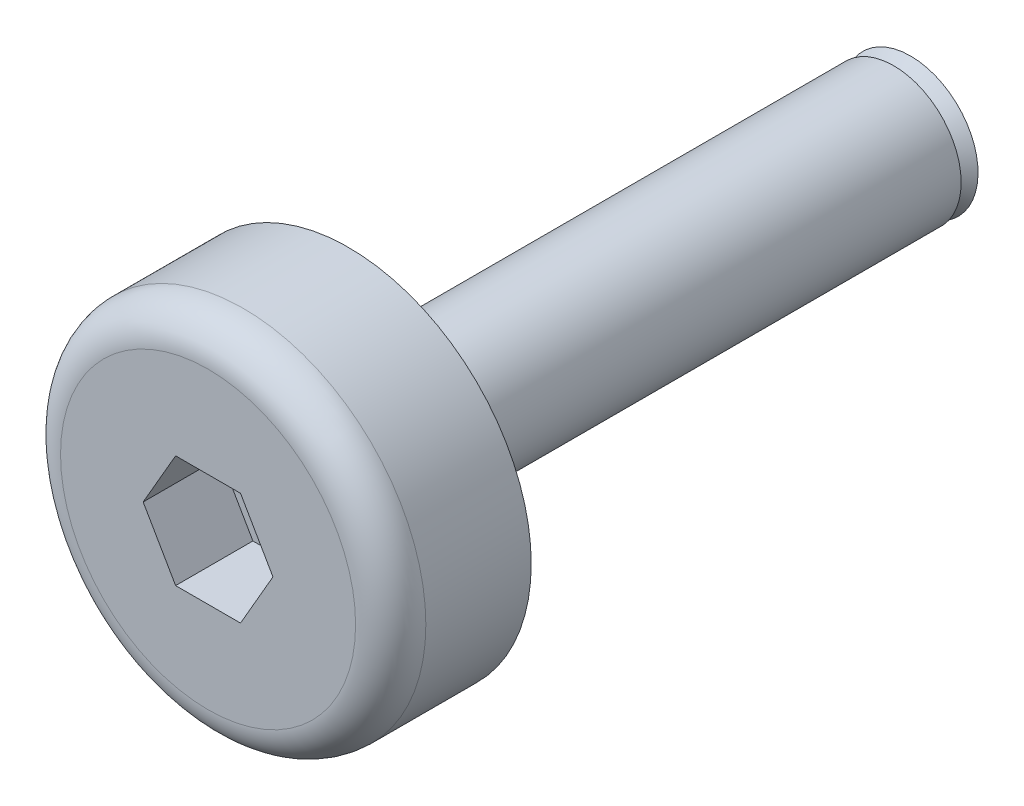
from build123d import *

# Parameters (mm, degrees)
F_0015_CYLINDER_SKETCH_R    = 3.25
F_0015_CYLINDER_DEPTH       = 2.5
F_0016_FILLET_R             = 0.625
F_0017_EXTRUDE_DEPTH        = 1.385
F_0017_EXTRUDE_ROTATE_ANGLE = 120
F_0020_CYLINDER_SKETCH_R    = 1.2
F_0020_CYLINDER_DEPTH       = 9.7
F_0021_CONE_ROTATE_ANGLE    = 90


with BuildPart() as part:
    # 0015_cylinder_Sketch → 0015_cylinder (new body)
    with BuildSketch(Plane.XY):
        Circle(F_0015_CYLINDER_SKETCH_R)
    extrude(amount=F_0015_CYLINDER_DEPTH)

    # 0016_fillet
    f_0016_fillet_edges = [part.edges().sort_by_distance(p)[0] for p in [
        (-3.25, 0, 2.5),
    ]]
    fillet(f_0016_fillet_edges, radius=F_0016_FILLET_R)


with BuildPart() as body_2:
    # 0017_extrude_Sketch → 0017_extrude (new body)
    with BuildSketch(Plane.XY):
        Polygon((0, 0), (1.154700538, 0), (1.732050808, 1), (1.154700538, 2), (0, 2), (-0.577350269, 1), align=None)
    extrude(amount=F_0017_EXTRUDE_DEPTH)


with BuildPart() as body_2_1:
    # 0017_extrude_Rotate: read off the stored shape, not the designer's step
    # 0017_extrude_Rotate: moved
    add(body_2.part.rotate(Axis((0, 0, 0), (0, 0, 1)), F_0017_EXTRUDE_ROTATE_ANGLE))


with BuildPart() as body_2_2:
    # 0017_extrude_Translate: moved
    add(body_2_1.part.moved(Location((1.154700538, 0, 1.125))))


with BuildPart() as part_1:
    add(part.part)

    # 0019_sub: cut body 2
    add(body_2_2.part, mode=Mode.SUBTRACT)


with BuildPart() as body_2_2_1:
    # 0020_cylinder_Sketch → 0020_cylinder (new body)
    with BuildSketch(Plane.XY):
        Circle(F_0020_CYLINDER_SKETCH_R)
    extrude(amount=F_0020_CYLINDER_DEPTH)


with BuildPart() as body_2_2_2:
    # 0020_cylinder_Translate: moved
    add(body_2_2_1.part.moved(Location((0, 0, -9.7))))


with BuildPart() as body_3:
    # 0021_cone_Sketch → 0021_cone (revolve)
    with BuildSketch(Plane.XY, mode=Mode.PRIVATE) as f_0021_cone_sk:
        Polygon((0, 0), (1.2, 0), (0.9, 0.3), (0, 0.3), align=None)
    revolve(f_0021_cone_sk.sketch.rotate(Axis((0, -100, 0), (0, 1, 0)), 90), axis=Axis((0, -100, 0), (0, 1, 0)))


with BuildPart() as body_3_1:
    # 0021_cone_Rotate: moved
    add(body_3.part.rotate(Axis((0, 0, 0), (1, 0, 0)), F_0021_CONE_ROTATE_ANGLE))


with BuildPart() as body_3_2:
    # 0021_cone_Translate: moved
    add(body_3_1.part.moved(Location((0, 0, -10))))


with BuildPart() as body_2_2_3:
    add(body_2_2_2.part)

    # 0023_add: union body 3
    add(body_3_2.part)


with BuildPart() as part_2:
    add(part_1.part)

    # 0024_add: union body 2 2
    add(body_2_2_3.part)


solid = part_2.part
